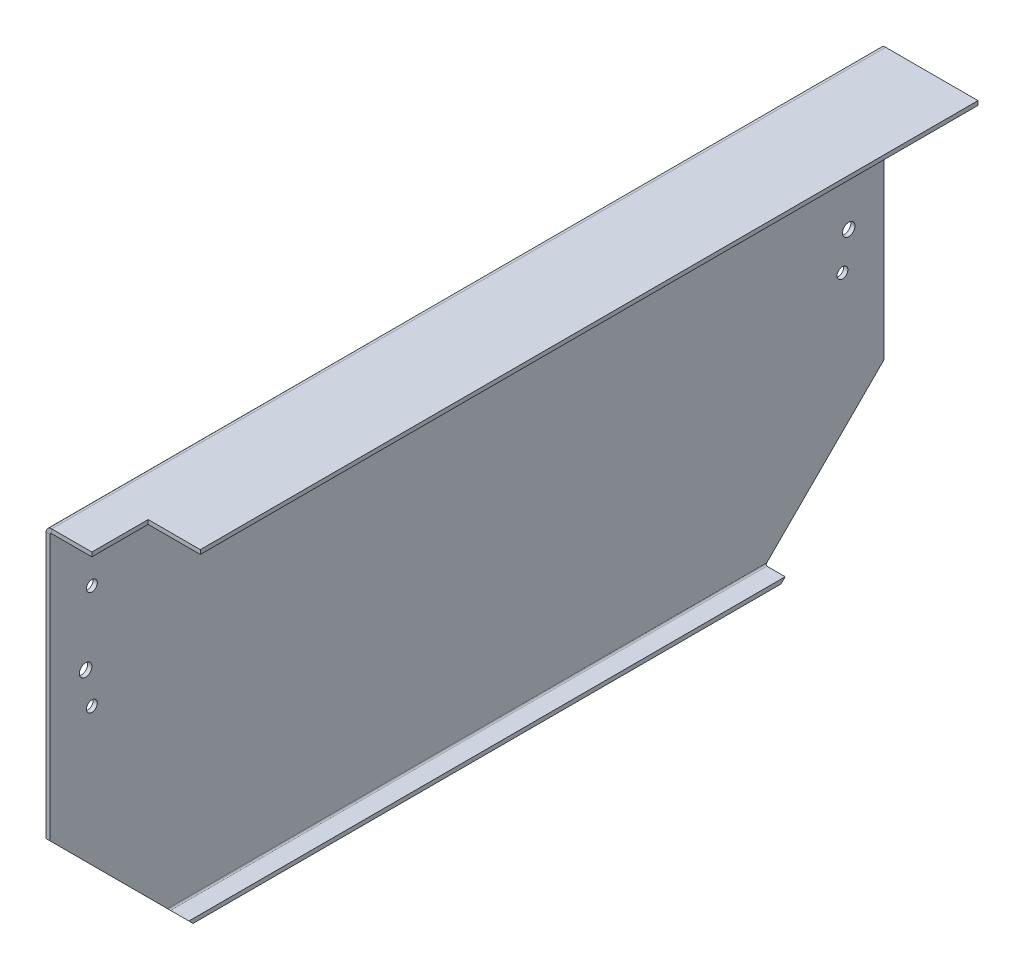
from build123d import *

# Parameters (mm, degrees)
SM_BASE_FLANGE_1_DEPTH           = 400
HOLE_WIZARD_5_2_5_2_1_AT_2_COUNT = 2
HOLE_WIZARD_5_2_5_2_1_AT_2_PITCH = 50
CUT_EXTRUDE_1_DEPTH              = 523.587791668
HOLE_WIZARD_6_0_6_1_D            = 6
HOLE_WIZARD_6_0_6_1_DEPTH        = 220
HOLE_WIZARD_6_0_6_1_TIP          = 1.802581857
SKETCH_11_W                      = 32.021510722
SKETCH_11_H                      = 35
CUT_EXTRUDE_2_DEPTH              = 25


# Sheet-metal steps are written as plain solids
with BuildPart() as part:
    # Sketch 1 → 基体-法兰1 (new body)
    with BuildSketch(Plane.XY):
        with BuildLine():
            Line((136, -146), (91.7366, -146))
            ThreePointArc((91.7366, -146), (91.215745145, -146.215745145), (91, -146.7366))
            Line((91, -146.7366), (91, -330.2634))
            ThreePointArc((91, -330.2634), (91.215745145, -330.784254855), (91.7366, -331))
            Line((91.7366, -331), (100.527645566, -331))
            Line((100.527645566, -331), (100.527645566, -333))
            Line((100.527645566, -333), (91.7366, -333))
            ThreePointArc((91.7366, -333), (89.801531583, -332.198468417), (89, -330.2634))
            Line((89, -330.2634), (89, -146.7366))
            ThreePointArc((89, -146.7366), (89.801531583, -144.801531583), (91.7366, -144))
            Line((91.7366, -144), (136, -144))
            Line((136, -144), (136, -146))
        make_face()
    extrude(amount=SM_BASE_FLANGE_1_DEPTH)

    # 草图6 → Ø5.2 (5.2) 直径孔1 (revolve, cut)
    with BuildSketch(Plane(origin=(89, -178, 380), x_dir=(0, 0, 1), z_dir=(0, 1, 0))):
        Polygon((0, 0), (0, 11.562237609), (2.6, 10), (2.6, 0), align=None)
    hole_wizard_5_2_5_2_1 = revolve(axis=Axis((82.65, -178, 380), (1, 0, 0)), mode=Mode.SUBTRACT)

    # Ø5.2 (5.2) 直径孔1 at 2: Ø5.2 (5.2) 直径孔1 ×2
    with Locations(*[(0, -i * HOLE_WIZARD_5_2_5_2_1_AT_2_PITCH, 0) for i in range(1, HOLE_WIZARD_5_2_5_2_1_AT_2_COUNT)]):
        add(hole_wizard_5_2_5_2_1, mode=Mode.SUBTRACT)

    # 镜向1: Ø5.2 (5.2) 直径孔1 across plane
    add(hole_wizard_5_2_5_2_1.mirror(Plane(origin=(0, 0, 200), x_dir=(1, 0, 0), z_dir=(0, 0, -1))), mode=Mode.SUBTRACT)

    # 镜向1 copy 1 sketch → 镜向1 copy 1 (revolve, cut)
    with BuildSketch(Plane(origin=(89, -228, 20), x_dir=(0, 0, -1), z_dir=(0, 1, 0))):
        Polygon((0, 0), (0, -11.562237609), (2.6, -10), (2.6, 0), align=None)
    revolve(axis=Axis((82.65, -228, 20), (-1, 0, 0)), mode=Mode.SUBTRACT)

    # 草图8 → 切除-拉伸1 (cut, symmetric)
    with BuildSketch(Plane.ZY.offset(-89)):
        Polygon((-267.508163369, -941.508163369), (334.373798762, -339.626201238), (400, -274), (1001.88196213, 327.88196213), (2205.645886391, -875.88196213), (936.255760892, -2145.27208763), align=None)
    cut_extrude_1 = extrude(amount=CUT_EXTRUDE_1_DEPTH, both=True, mode=Mode.SUBTRACT)

    # 镜向2: 切除-拉伸1 across plane
    add(cut_extrude_1.mirror(Plane(origin=(0, 0, 200), x_dir=(1, 0, 0), z_dir=(0, 0, -1))), mode=Mode.SUBTRACT)

    # Ø6.0 (6) 直径孔1
    with Locations(Plane.ZY.offset(-89)):
        with Locations((17, -211.5), (383, -211.5)):
            Hole(HOLE_WIZARD_6_0_6_1_D / 2, depth=HOLE_WIZARD_6_0_6_1_DEPTH)
            with Locations((0, 0, -(HOLE_WIZARD_6_0_6_1_DEPTH + HOLE_WIZARD_6_0_6_1_TIP / 2))):  # 118° drill point
                Cone(0, HOLE_WIZARD_6_0_6_1_D / 2, HOLE_WIZARD_6_0_6_1_TIP, mode=Mode.SUBTRACT)

    # 草图11 → 切除-拉伸2 (cut)
    with BuildSketch(Plane(origin=(0, -144, 0), x_dir=(1, 0, 0), z_dir=(0, 1, 0))):
        with Locations((127.010755361, -390.5)):
            Rectangle(SKETCH_11_W, SKETCH_11_H)
    extrude(amount=-CUT_EXTRUDE_2_DEPTH, mode=Mode.SUBTRACT)


solid = part.part
